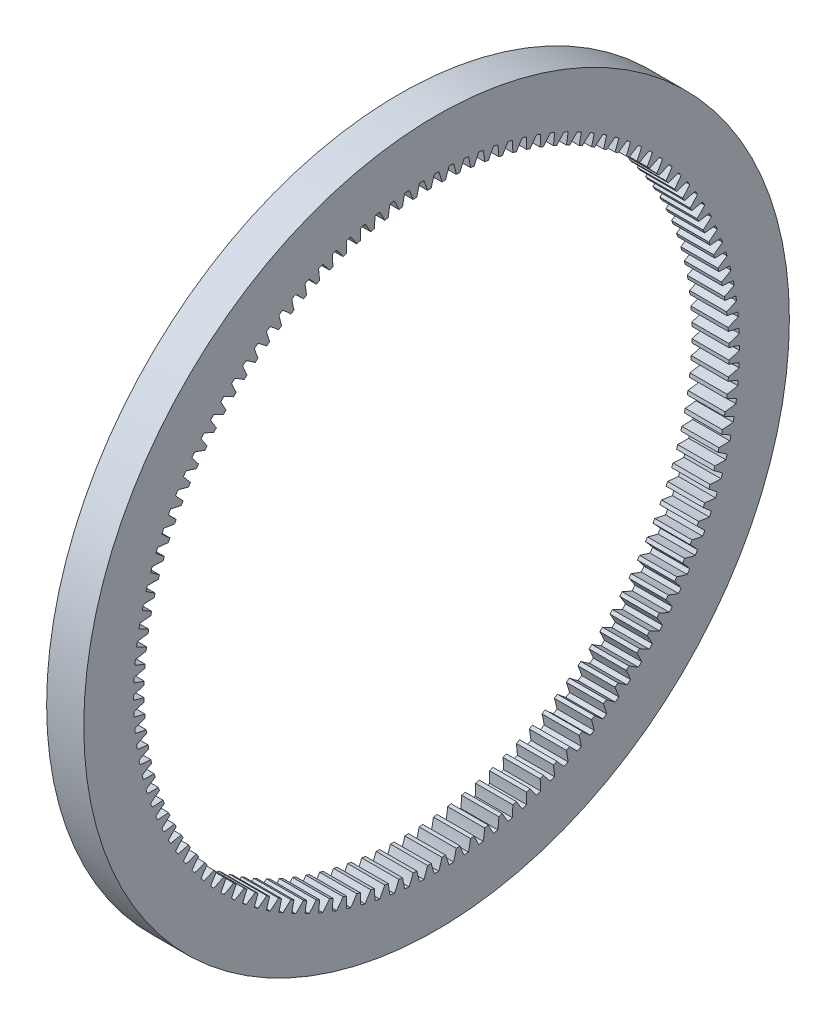
from build123d import *

# Parameters (mm, degrees)
BASPROSKE_W     = 10
BASPROSKE_H     = 16.25
TOOTHCUT_DEPTH  = 135.721935853
TEETHCUTS_COUNT = 128
TEETHCUTS_ANGLE = 357.1875


with BuildPart() as part:
    # BasProSke → Base-Revolve (revolve)
    with BuildSketch(Plane(origin=(0, 0, 0), x_dir=(1, 0, 0), z_dir=(0, 1, 0))):
        with Locations((5, 86.875)):
            Rectangle(BASPROSKE_W, BASPROSKE_H)
    revolve(axis=Axis((-10, 0, 0), (1, 0, 0)))

    # TooCutSke → ToothCut (cut, through all)
    with BuildSketch(Plane(origin=(0, 0, 0), x_dir=(0, 0, -1), z_dir=(1, 0, 0))):
        with BuildLine():
            ThreePointArc((1.44423827, 78.711351284), (1.049758145, 80.144134711), (0.602328094, 81.561275941))
            ThreePointArc((0.602328094, 81.561275941), (0, 81.5635), (-0.602328094, 81.561275941))
            ThreePointArc((-0.602328094, 81.561275941), (-1.049758145, 80.144134711), (-1.44423827, 78.711351284))
            ThreePointArc((-1.44423827, 78.711351284), (0, 78.7246), (1.44423827, 78.711351284))
        make_face()
    toothcut = extrude(amount=TOOTHCUT_DEPTH, mode=Mode.SUBTRACT)

    # TeethCuts: ToothCut ×128 about axis
    teethcuts_axis = Axis((-10, 0, 0), (1, 0, 0))
    for i in range(1, TEETHCUTS_COUNT):
        add(toothcut.rotate(teethcuts_axis, i * TEETHCUTS_ANGLE / (TEETHCUTS_COUNT - 1)), mode=Mode.SUBTRACT)


solid = part.part
